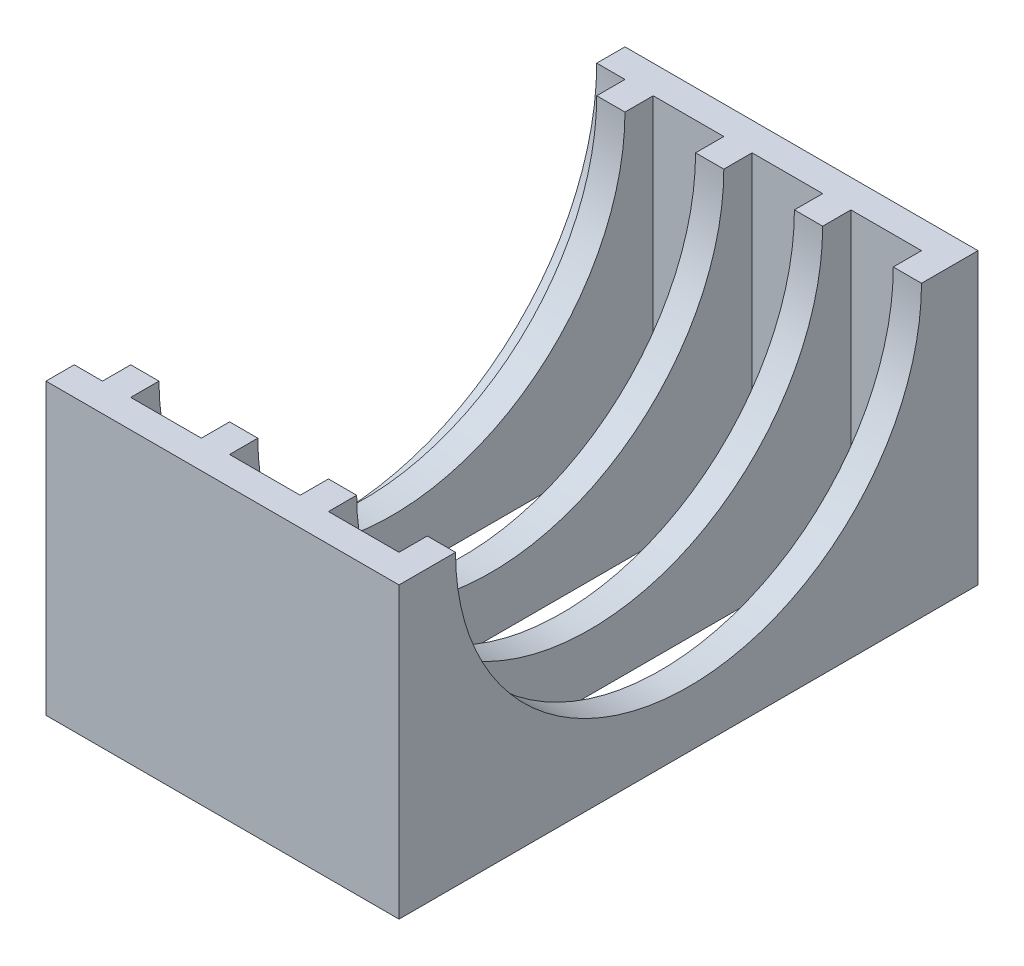
from build123d import *

# Parameters (mm, degrees)
SKETCH_1_W             = 25
SKETCH_1_H             = 41
EXTRUDE_415_DEPTH      = 2
SKETCH_5_W             = 25
SKETCH_5_H             = 2
EXTRUDE_624_DEPTH      = 18.5
SKETCH_7_W             = 4
SKETCH_7_H             = 37
SKETCH_7_W_2           = 2
EXTRUDE_1329_DEPTH     = 18.5
SKETCH_8_R             = 18.5
CUT_EXTRUDE_1469_DEPTH = 2
SKETCH_9_R             = 16.5
CUT_EXTRUDE_1600_DEPTH = 23
SKETCH_10_W            = 5
SKETCH_10_H            = 37
CUT_EXTRUDE_1826_DEPTH = 2


with BuildPart() as part:
    # 草图1 → Extrude 415 (new body)
    with BuildSketch(Plane(origin=(0, 0, 0), x_dir=(1, 0, 0), z_dir=(0, 1, 0))):
        with Locations((12.5, 20.5)):
            Rectangle(SKETCH_1_W, SKETCH_1_H)
    extrude(amount=EXTRUDE_415_DEPTH)

    # 草图5 → Extrude 624 (add)
    with BuildSketch(Plane(origin=(0, 2, 0), x_dir=(1, 0, 0), z_dir=(0, 1, 0))):
        with Locations((12.5, 40)):
            Rectangle(SKETCH_5_W, SKETCH_5_H)
        with Locations((12.5, 1)):
            Rectangle(SKETCH_5_W, SKETCH_5_H)
    extrude(amount=EXTRUDE_624_DEPTH)

    # 草图7 → Extrude 1329 (add)
    with BuildSketch(Plane(origin=(0, 2, 0), x_dir=(1, 0, 0), z_dir=(0, 1, 0))):
        with Locations((2, 20.5)):
            Rectangle(SKETCH_7_W, SKETCH_7_H)
        with Locations((10, 20.5)):
            Rectangle(SKETCH_7_W_2, SKETCH_7_H)
        with Locations((17, 20.5)):
            Rectangle(SKETCH_7_W_2, SKETCH_7_H)
        with Locations((24, 20.5)):
            Rectangle(SKETCH_7_W_2, SKETCH_7_H)
    extrude(amount=EXTRUDE_1329_DEPTH)

    # 草图8 → Cut-Extrude 1469 (cut)
    with BuildSketch(Plane.ZY):
        with Locations((-20.5, 20.5)):
            Circle(SKETCH_8_R)
    extrude(amount=-CUT_EXTRUDE_1469_DEPTH, mode=Mode.SUBTRACT)

    # 草图9 → Cut-Extrude 1600 (cut)
    with BuildSketch(Plane(origin=(25, 0, 0), x_dir=(0, 0, -1), z_dir=(1, 0, 0))):
        with Locations((20.5, 20.5)):
            Circle(SKETCH_9_R)
    extrude(amount=-CUT_EXTRUDE_1600_DEPTH, mode=Mode.SUBTRACT)

    # 草图10 → Cut-Extrude 1826 (cut)
    with BuildSketch(Plane(origin=(0, 2, 0), x_dir=(1, 0, 0), z_dir=(0, 1, 0))):
        with Locations((6.5, 20.5)):
            Rectangle(SKETCH_10_W, SKETCH_10_H)
        with Locations((13.5, 20.5)):
            Rectangle(SKETCH_10_W, SKETCH_10_H)
        with Locations((20.5, 20.5)):
            Rectangle(SKETCH_10_W, SKETCH_10_H)
    extrude(amount=-CUT_EXTRUDE_1826_DEPTH, mode=Mode.SUBTRACT)


solid = part.part
